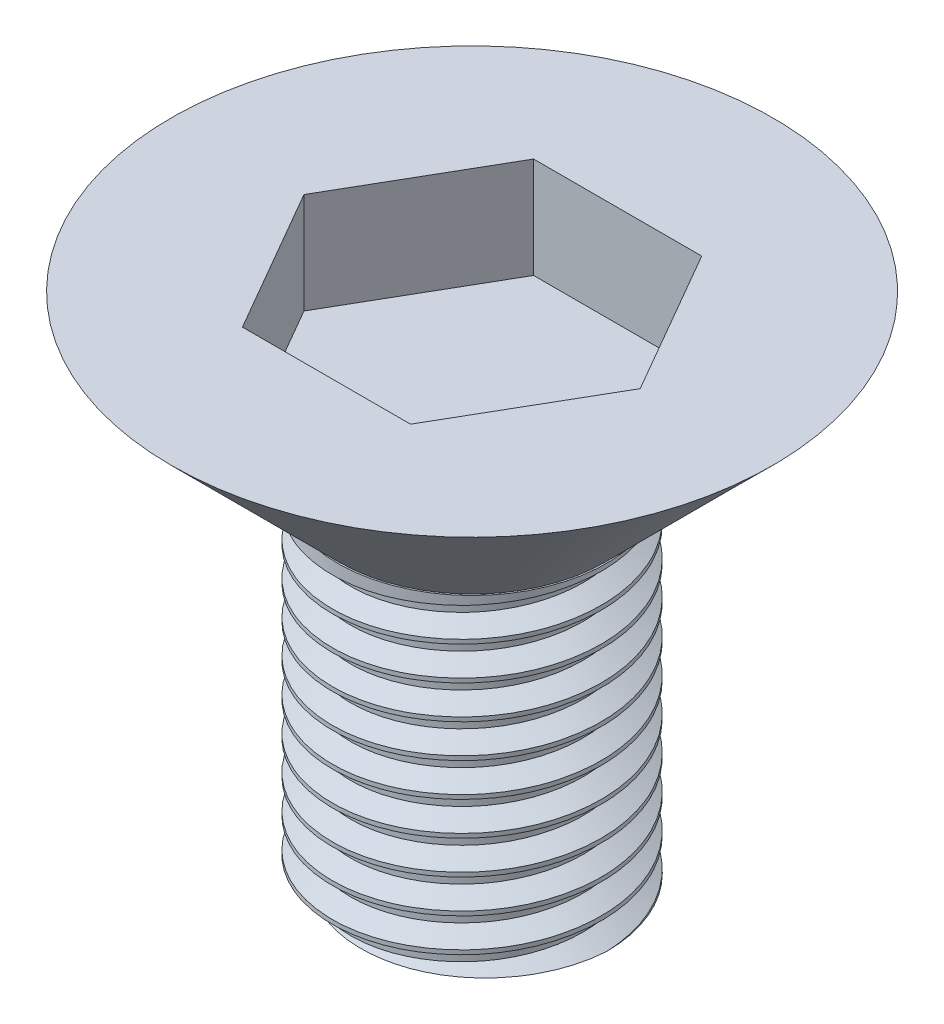
from build123d import *

# Parameters (mm, degrees)
CROQUIS1_R              = 8.95
SALIENTE_EXTRUIR1_DEPTH = 5
SALIENTE_EXTRUIR1_DRAFT = -45
CROQUIS2_R              = 4
SALIENTE_EXTRUIR2_DEPTH = 10
ROSCA1_PITCH            = 1
CORTAR_EXTRUIR1_DEPTH   = 3


with BuildPart() as part:
    # Croquis1 → Saliente-Extruir1 (with draft: the straight prism first)
    with BuildSketch(Plane(origin=(0, 0, 0), x_dir=(1, 0, 0), z_dir=(0, 1, 0))):
        Circle(CROQUIS1_R)
    extrude(amount=-SALIENTE_EXTRUIR1_DEPTH)
    # Saliente-Extruir1: the draft: its side faces are tilted about the plane it starts from
    saliente_extruir1_sides = [part.faces().sort_by_distance(p)[0] for p in [
        (-8.95, -2.5, 0),
    ]]
    draft(saliente_extruir1_sides, Plane(origin=(0, 0, 0), x_dir=(1, 0, 0), z_dir=(0, 1, 0)), SALIENTE_EXTRUIR1_DRAFT)

    # Croquis2 → Saliente-Extruir2 (add)
    with BuildSketch(Plane.XZ.offset(5)):
        with Locations(Location((0, 0, 0), (0, 0, 270))):
            Circle(CROQUIS2_R)
    extrude(amount=SALIENTE_EXTRUIR2_DEPTH)

    # Rosca1: the profile of Perfil de rosca1 profile screwed along a right-hand helix of 10.5 turns, 8 arcs to a turn; built about Z, then put on its axis
    rosca1_z = Axis((0, 0, 0), (0, 0, 1))
    rosca1_corners = [(4.0003, 0, -0.000173205), (4.0003, 0, 0.875173202), (3.458734125, 0, 0.562499999), (3.458734125, 0, 0.312499999)]
    with BuildLine(mode=Mode.PRIVATE) as rosca1_profile:
        Line(rosca1_corners[0], rosca1_corners[1])
        Line(rosca1_corners[1], rosca1_corners[2])
        Line(rosca1_corners[2], rosca1_corners[3])
        Line(rosca1_corners[3], rosca1_corners[0])
    rosca1_cap = Face(rosca1_profile.wire())
    rosca1_turn_angles = [0, 22.5, 45, 67.5, 90, 112.5, 135, 157.5, 180, 202.5, 225, 247.5, 270, 292.5, 315, 337.5, 360]
    rosca1_turn_weights = [1, 0.9238795325112867, 1, 0.9238795325112867, 1, 0.9238795325112867, 1, 0.9238795325112867, 1, 0.9238795325112867, 1, 0.9238795325112867, 1, 0.9238795325112867, 1, 0.9238795325112867, 1]
    rosca1_turn_rails = [Edge.make_bspline([Vector(p[0], p[1], 0).rotate(rosca1_z, rosca1_turn_angles[k]) / rosca1_turn_weights[k] + Vector(0, 0, p[2] + ROSCA1_PITCH * rosca1_turn_angles[k] / 360) for k in range(17)], [0, 0, 0, 1, 1, 2, 2, 3, 3, 4, 4, 5, 5, 6, 6, 7, 7, 8, 8, 8], 2, rosca1_turn_weights) for p in rosca1_corners]
    rosca1_turn_sides = [Face.make_surface_from_curves(rosca1_turn_rails[p[0]], rosca1_turn_rails[p[1]]) for p in [(0, 1), (1, 2), (2, 3), (3, 0)]]
    rosca1_last_angles = [3600, 3622.5, 3645, 3667.5, 3690, 3712.5, 3735, 3757.5, 3780]
    rosca1_last_weights = [1, 0.9238795325112867, 1, 0.9238795325112867, 1, 0.9238795325112867, 1, 0.9238795325112867, 1]
    rosca1_last_rails = [Edge.make_bspline([Vector(p[0], p[1], 0).rotate(rosca1_z, rosca1_last_angles[k]) / rosca1_last_weights[k] + Vector(0, 0, p[2] + ROSCA1_PITCH * rosca1_last_angles[k] / 360) for k in range(9)], [0, 0, 0, 1, 1, 2, 2, 3, 3, 4, 4, 4], 2, rosca1_last_weights) for p in rosca1_corners]
    rosca1_last_sides = [Face.make_surface_from_curves(rosca1_last_rails[p[0]], rosca1_last_rails[p[1]]) for p in [(0, 1), (1, 2), (2, 3), (3, 0)]]
    rosca1 = Plane(origin=(0, -16, 0), x_dir=(1, 0, 0), z_dir=(0, 1, 0)) * Solid(Shell([*[p.moved(Location((0, 0, ROSCA1_PITCH * i))) for i in range(10) for p in rosca1_turn_sides], *rosca1_last_sides, rosca1_cap, rosca1_cap.rotate(rosca1_z, 3780).moved(Location((0, 0, ROSCA1_PITCH * 3780 / 360)))]))
    add(rosca1, mode=Mode.SUBTRACT)

    # Croquis5 → Cortar-Extruir1 (cut)
    with BuildSketch(Plane(origin=(0, 0, 0), x_dir=(1, 0, 0), z_dir=(0, 1, 0))):
        Polygon((5, 0), (2.5, 4.330127019), (-2.5, 4.330127019), (-5, 0), (-2.5, -4.330127019), (2.5, -4.330127019), align=None)
    extrude(amount=-CORTAR_EXTRUIR1_DEPTH, mode=Mode.SUBTRACT)


solid = part.part
